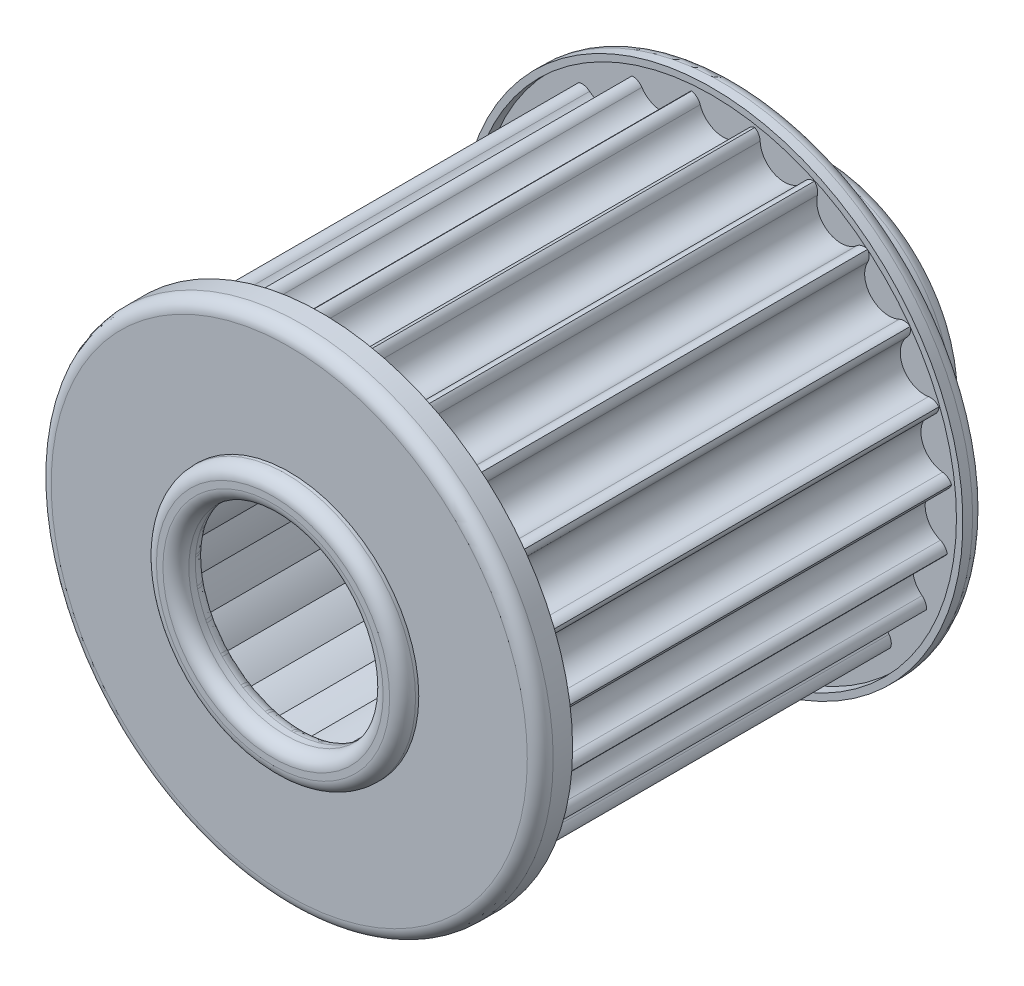
from build123d import *

# Parameters (mm, degrees)
SKETCH3_R                = 72.5
BOSS_EXTRUDE1_DEPTH      = 128
CUT_EXTRUDE1_DEPTH       = 128
FILLET1_R                = 3.5
CIRPATTERN1_COUNT        = 23
FILLET1_OF_CIRPATTERN1_R = 3.5
CUT_EXTRUDE2_DEPTH       = 128
BOSS_EXTRUDE2_DEPTH      = 4
BOSS_EXTRUDE3_START      = -4
SKETCH7_R                = 77.499998443
BOSS_EXTRUDE3_DEPTH      = 10
SKETCH8_R                = 40
CUT_EXTRUDE3_DEPTH       = 27
BOSS_EXTRUDE4_DEPTH      = 53.5
BOSS_EXTRUDE6_START      = 5
SKETCH10_R               = 40
SKETCH10_R_2             = 30
BOSS_EXTRUDE6_DEPTH      = 10
FILLET2_R                = 4


with BuildPart() as part:
    # Sketch2 → Revolve2 (revolve)
    with BuildSketch(Plane(origin=(0, 0, 0), x_dir=(1, 0, 0), z_dir=(0, 1, 0)), mode=Mode.PRIVATE) as revolve2_sk:
        Polygon((37.5, 21.100238458), (37.5, 17.600238458), (39.5, 17.600238458), (39.5, 21.100238458), (75.5, 21.100238458), (75.5, 17.600238458), (77.5, 17.600238458), (77.5, 24.600238458), (50, 24.600238458), (43, 31.600238458), (43, 52.600238458), (37.5, 52.600238458), align=None)
    revolve(revolve2_sk.sketch.rotate(Axis((1.557e-06, 0, -52.600238458), (0, 0, 1)), 180), axis=Axis((1.557e-06, 0, -52.600238458), (0, 0, 1)))

    # Sketch3 → Boss-Extrude1 (add)
    with BuildSketch(Plane.XY.offset(-21.100238458)):
        with Locations(Location((0, 0, 0), (0, 0, 180))):
            Circle(SKETCH3_R)
    extrude(amount=BOSS_EXTRUDE1_DEPTH)

    # Sketch4 → Cut-Extrude1 (cut)
    with BuildSketch(Plane.XY.offset(106.899761542)):
        with BuildLine():
            Line((7.5, 70), (10, 70))
            Line((10, 70), (10, 74.834816737))
            ThreePointArc((10, 74.834816737), (-1.4e-08, 75.499998443), (-10, 74.83481632))
            Line((-10, 74.83481632), (-10, 70))
            Line((-10, 70), (-7.5, 70))
            ThreePointArc((-7.5, 70), (0, 62.5), (7.5, 70))
        make_face()
    cut_extrude1 = extrude(amount=-CUT_EXTRUDE1_DEPTH, mode=Mode.SUBTRACT)

    # Fillet1
    # the kernel refuses this fillet: 3.5 mm, written as the material it takes off along each edge
    with BuildSketch(Plane(origin=(7.5, 70, 113.149761542), x_dir=(-0.15990053726672196, -0.9871331309310886, 0), z_dir=(0, 0, -1))) as fillet1_piece_1:
        with BuildLine():
            CenterArc((2.958159939, -3.454965958), FILLET1_R, 99.201123098, 64.416998023)
            Line((-0.399751343, -2.467832827), (-0.466909569, -2.448090165))
            ThreePointArc((-0.466909569, -2.448090165), (-0.268974991, -1.222723376), (-0.069099319, 0.011193038))
            Line((-0.069099319, 0.011193038), (0.011193038, 0.069099319))
            ThreePointArc((0.011193038, 0.069099319), (1.19925403, -0.026501518), (2.387315021, 0.069099319))
            Line((2.387315021, 0.069099319), (2.398508059, 0))
        make_face()
    extrude(amount=134.25, mode=Mode.SUBTRACT)
    with BuildSketch(Plane(origin=(-7.5, 70, 113.149761542), x_dir=(-1, 0, 0), z_dir=(0, 0, -1))) as fillet1_piece_2:
        with BuildLine():
            CenterArc((2.9375, -3.472548596), FILLET1_R, 97.180755781, 64.416998023)
            Line((-0.383522727, -2.36764677), (-0.449943182, -2.345548733))
            ThreePointArc((-0.449943182, -2.345548733), (-0.165600837, -1.188060992), (-0.07, 0))
            Line((-0.07, 0), (0, 0.07))
            ThreePointArc((0, 0.07), (1.25, 0.07), (2.49125, 0.069450972))
            Line((2.49125, 0.069450972), (2.5, 0))
        make_face()
    extrude(amount=134.25, mode=Mode.SUBTRACT)

    # CirPattern1: Cut-Extrude1 ×23 about axis
    cirpattern1_axis = Axis((0, 0, 106.899761542), (0, 0, 1))
    for i in range(1, CIRPATTERN1_COUNT):
        add(cut_extrude1.rotate(cirpattern1_axis, i * 360 / CIRPATTERN1_COUNT), mode=Mode.SUBTRACT)

    # Fillet1 of CirPattern1
    # the kernel refuses this fillet: 3.5 mm, written as the material it takes off along each edge
    with BuildSketch(Plane(origin=(-11.663894326, 69.427685898, 112.687052105), x_dir=(0.11795967062935775, -0.9930183865896007, 0), z_dir=(0, 0, -1))) as fillet1_of_cirpattern1_piece_1:
        with BuildLine():
            CenterArc((2.855063344, -3.458068983), FILLET1_OF_CIRPATTERN1_R, 98.877809953, 55.66765125)
            Line((-0.305179714, -1.953787158), (-0.368384576, -1.923701521))
            ThreePointArc((-0.368384576, -1.923701521), (-0.221751237, -0.966090636), (-0.06916138, 0.010802942))
            Line((-0.06916138, 0.010802942), (0.010802942, 0.06916138))
            ThreePointArc((0.010802942, 0.06916138), (1.157458113, -0.01985218), (2.304113283, 0.06916138))
            Line((2.304113283, 0.06916138), (2.314916225, 0))
        make_face()
    extrude(amount=133.787290563, mode=Mode.SUBTRACT)
    with BuildSketch(Plane(origin=(-26.107653636, 65.380734331, 112.763038335), x_dir=(-0.962917287347799, -0.2697967711570246, 0), z_dir=(0, 0, -1)), Plane(origin=(-42.779022037, 55.912478693, 112.763038335), x_dir=(-0.8544194045464892, -0.5195839500354325, 0), z_dir=(0, 0, -1)), Plane(origin=(-56.277666074, 42.297450293, 112.763038335), x_dir=(-0.6825531432186525, -0.7308359642781255, 0), z_dir=(0, 0, -1)), Plane(origin=(-65.602453071, 25.545413503, 112.763038335), x_dir=(-0.46006503773115265, -0.8878852184023749, 0), z_dir=(0, 0, -1)), Plane(origin=(-70.061806236, 6.898790256, 112.763038335), x_dir=(-0.20345601305263047, -0.9790840876823237, 0), z_dir=(0, 0, -1)), Plane(origin=(-69.324995743, -12.259484704, 112.763038335), x_dir=(0.06824241336466162, -0.9976687691905398, 0), z_dir=(0, 0, -1)), Plane(origin=(-63.446667457, -30.508529768, 112.763038335), x_dir=(0.33487961217098966, -0.9422609221188193, 0), z_dir=(0, 0, -1)), Plane(origin=(-52.862790095, -46.494896746, 112.763038335), x_dir=(0.5766803221148681, -0.8169698930104413, 0), z_dir=(0, 0, -1)), Plane(origin=(-38.358321423, -59.032949932, 112.763038335), x_dir=(0.7757112907044159, -0.6310879443260576, 0), z_dir=(0, 0, -1)), Plane(origin=(-21.008991528, -67.192799279, 112.763038335), x_dir=(0.9172113015054586, -0.39840108984622863, 0), z_dir=(0, 0, -1)), Plane(origin=(-2.101520841, -70.369266091, 112.763038335), x_dir=(0.9906859460363303, -0.1361666490962488, 0), z_dir=(0, 0, -1)), Plane(origin=(16.961810032, -68.326766354, 112.763038335), x_dir=(0.990685946036331, 0.13616664909624518, 0), z_dir=(0, 0, -1)), Plane(origin=(34.767161051, -61.216782932, 112.763038335), x_dir=(0.9172113015054544, 0.3984010898462381, 0), z_dir=(0, 0, -1)), Plane(origin=(49.993990783, -49.566630767, 112.763038335), x_dir=(0.7757112907044208, 0.6310879443260516, 0), z_dir=(0, 0, -1)), Plane(origin=(61.512994927, -34.24034835, 112.763038335), x_dir=(0.5766803221148689, 0.8169698930104408, 0), z_dir=(0, 0, -1)), Plane(origin=(68.46986164, -16.374615936, 112.763038335), x_dir=(0.3348796121709904, 0.942260922118819, 0), z_dir=(0, 0, -1)), Plane(origin=(70.348631944, 2.705546833, 112.763038335), x_dir=(0.06824241336467309, 0.997668769190539, 0), z_dir=(0, 0, -1)), Plane(origin=(67.00996604, 21.585051571, 112.763038335), x_dir=(-0.20345601305263206, 0.9790840876823232, 0), z_dir=(0, 0, -1)), Plane(origin=(58.701477505, 38.863691779, 112.763038335), x_dir=(-0.46006503773115587, 0.8878852184023734, 0), z_dir=(0, 0, -1)), Plane(origin=(46.039368925, 53.259989757, 112.763038335), x_dir=(-0.6825531432186541, 0.7308359642781241, 0), z_dir=(0, 0, -1)), Plane(origin=(29.962730968, 63.706237944, 112.763038335), x_dir=(-0.8544194045464872, 0.5195839500354358, 0), z_dir=(0, 0, -1))) as fillet1_of_cirpattern1_piece_2:
        with BuildLine():
            CenterArc((2.962175058, -3.397483341), FILLET1_OF_CIRPATTERN1_R, 103.901658842, 58.107671101)
            Line((-0.366698824, -2.316465914), (-0.433276302, -2.294845566))
            ThreePointArc((-0.433276302, -2.294845566), (-0.16138102, -1.161710575), (-0.07, 0))
            Line((-0.07, 0), (0, 0.07))
            ThreePointArc((0, 0.07), (1.060639272, 0.07), (2.104460614, 0.067949667))
            Line((2.104460614, 0.067949667), (2.121278544, 0))
        make_face()
    extrude(amount=133.863276793, mode=Mode.SUBTRACT)
    with BuildSketch(Plane(origin=(-29.962730968, 63.706237944, 112.763038335), x_dir=(0.37960169309444297, -0.9251500173484473, 0), z_dir=(0, 0, -1)), Plane(origin=(-46.039368925, 53.259989757, 112.763038335), x_dir=(0.6151275201036107, -0.7884276339723145, 0), z_dir=(0, 0, -1)), Plane(origin=(-58.701477505, 38.863691779, 112.763038335), x_dir=(0.805032152967851, -0.593231179800882, 0), z_dir=(0, 0, -1)), Plane(origin=(-67.00996604, 21.585051571, 112.763038335), x_dir=(0.9352312338235118, -0.35403748287568637, 0), z_dir=(0, 0, -1)), Plane(origin=(-70.348631944, 2.705546833, 112.763038335), x_dir=(0.9960684924646918, -0.08858644545931603, 0), z_dir=(0, 0, -1)), Plane(origin=(-68.46986164, -16.374615936, 112.763038335), x_dir=(0.9830319077299143, 0.18343464336074958, 0), z_dir=(0, 0, -1)), Plane(origin=(-61.512994927, -34.24034835, 112.763038335), x_dir=(0.8970883434705509, 0.44185122384040426, 0), z_dir=(0, 0, -1)), Plane(origin=(-49.993990783, -49.566630767, 112.763038335), x_dir=(0.7446118406820741, 0.6674977203826642, 0), z_dir=(0, 0, -1)), Plane(origin=(-34.767161051, -61.216782932, 112.763038335), x_dir=(0.5369108840427165, 0.8436389646030277, 0), z_dir=(0, 0, -1)), Plane(origin=(-16.961810032, -68.326766354, 112.763038335), x_dir=(0.28938970333776953, 0.9572113662102418, 0), z_dir=(0, 0, -1)), Plane(origin=(2.101520841, -70.369266091, 112.763038335), x_dir=(0.020405812206061157, 0.9997917797362664, 0), z_dir=(0, 0, -1)), Plane(origin=(21.008991528, -67.192799279, 112.763038335), x_dir=(-0.2500914846665885, 0.9682222107023065, 0), z_dir=(0, 0, -1)), Plane(origin=(38.358321423, -59.032949932, 112.763038335), x_dir=(-0.5020406402139345, 0.8648440296224417, 0), z_dir=(0, 0, -1)), Plane(origin=(52.862790095, -46.494896746, 112.763038335), x_dir=(-0.7167557381597204, 0.6973243232636549, 0), z_dir=(0, 0, -1)), Plane(origin=(63.446667457, -30.508529768, 112.763038335), x_dir=(-0.8783123419455172, 0.4780872618949189, 0), z_dir=(0, 0, -1)), Plane(origin=(69.324995743, -12.259484704, 112.763038335), x_dir=(-0.9747285373408227, 0.2233926554151242, 0), z_dir=(0, 0, -1)), Plane(origin=(70.061806236, 6.898790256, 112.763038335), x_dir=(-0.9988535762079076, -0.047869962363407875, 0), z_dir=(0, 0, -1)), Plane(origin=(65.602453071, 25.545413503, 112.763038335), x_dir=(-0.9488982147787105, -0.3155822840239548, 0), z_dir=(0, 0, -1)), Plane(origin=(56.277666074, 42.297450293, 112.763038335), x_dir=(-0.8285674136798642, -0.5598893113713288, 0), z_dir=(0, 0, -1)), Plane(origin=(42.779022037, 55.912478693, 112.763038335), x_dir=(-0.6467855579520825, -0.7626719098174609, 0), z_dir=(0, 0, -1))) as fillet1_of_cirpattern1_piece_3:
        with BuildLine():
            CenterArc((2.892549884, -3.456953759), FILLET1_OF_CIRPATTERN1_R, 98.995335028, 58.107671101)
            Line((-0.331670487, -2.095189097), (-0.396154894, -2.067953803))
            ThreePointArc((-0.396154894, -2.067953803), (-0.234974319, -1.036649765), (-0.069139075, 0.010944783))
            Line((-0.069139075, 0.010944783), (0.010944783, 0.069139075))
            ThreePointArc((0.010944783, 0.069139075), (1.172655359, -0.022241944), (2.334365934, 0.069139075))
            Line((2.334365934, 0.069139075), (2.345310717, 0))
        make_face()
    extrude(amount=133.863276793, mode=Mode.SUBTRACT)
    with BuildSketch(Plane(origin=(26.107653636, 65.380734331, 112.763038335), x_dir=(0.9629172873477997, -0.2697967711570225, 0), z_dir=(0, 0, -1))) as fillet1_of_cirpattern1_piece_4:
        with BuildLine():
            CenterArc((2.962175058, 3.397483341), FILLET1_OF_CIRPATTERN1_R, 197.990670057, 58.107671101)
            Line((-0.366698824, 2.316465914), (-0.433276302, 2.294845566))
            ThreePointArc((-0.433276302, 2.294845566), (-0.16138102, 1.161710575), (-0.07, 0))
            Line((-0.07, 0), (0, -0.07))
            ThreePointArc((0, -0.07), (1.060639272, -0.07), (2.104460614, -0.067949667))
            Line((2.104460614, -0.067949667), (2.121278544, 0))
        make_face()
    extrude(amount=133.863276793, mode=Mode.SUBTRACT)
    with BuildSketch(Plane(origin=(11.663894326, 69.427685898, 112.687052105), x_dir=(-0.9629172873477976, 0.2697967711570304, 0), z_dir=(0, 0, -1))) as fillet1_of_cirpattern1_piece_5:
        with BuildLine():
            CenterArc((2.976024814, -3.354534855), FILLET1_OF_CIRPATTERN1_R, 106.576728844, 55.66765125)
            Line((-0.357255809, -2.287182856), (-0.423921421, -2.265835816))
            ThreePointArc((-0.423921421, -2.265835816), (-0.159013559, -1.14665517), (-0.07, 0))
            Line((-0.07, 0), (0, 0.07))
            ThreePointArc((0, 0.07), (0.988738959, 0.07), (1.95750698, 0.067090697))
            Line((1.95750698, 0.067090697), (1.977477918, 0))
        make_face()
    extrude(amount=133.787290563, mode=Mode.SUBTRACT)

    # Sketch5 → Cut-Extrude2 (cut)
    with BuildSketch(Plane.XY.offset(106.899761542)):
        with BuildLine():
            ThreePointArc((-44.665046725, 31.528032738), (-38.368888125, 35.834040019), (-34.502584198, 42.40937315))
            ThreePointArc((-34.502584198, 42.40937315), (-27.278157377, 44.857018739), (-21.78122284, 50.145404365))
            ThreePointArc((-21.78122284, 50.145404365), (-14.164330486, 50.553157586), (-7.444447826, 54.162380338))
            ThreePointArc((-7.444447826, 54.162380338), (0, 52.5), (7.444447826, 54.162380338))
            ThreePointArc((7.444447826, 54.162380338), (14.164330486, 50.553157586), (21.78122284, 50.145404365))
            ThreePointArc((21.78122284, 50.145404365), (27.278157377, 44.857018739), (34.502584198, 42.40937315))
            ThreePointArc((34.502584198, 42.40937315), (38.368888125, 35.834040019), (44.665046725, 31.528032738))
            ThreePointArc((44.665046725, 31.528032738), (46.613973966, 24.153414481), (51.514907066, 18.308402369))
            ThreePointArc((51.514907066, 18.308402369), (51.401914603, 10.681440685), (54.544142414, 3.730921553))
            ThreePointArc((54.544142414, 3.730921553), (52.377610383, -3.582726702), (53.528088242, -11.123264648))
            ThreePointArc((53.528088242, -11.123264648), (49.468698411, -17.581179639), (48.54210064, -25.152489195))
            ThreePointArc((48.54210064, -25.152489195), (42.890919383, -30.275716911), (39.955967499, -37.316268684))
            ThreePointArc((39.955967499, -37.316268684), (33.132117077, -40.724842762), (28.406483035, -46.712471235))
            ThreePointArc((28.406483035, -46.712471235), (20.916057217, -48.153593329), (14.750219675, -52.64422349))
            ThreePointArc((14.750219675, -52.64422349), (7.148749078, -52.011012167), (0, -54.67159452))
            ThreePointArc((0, -54.67159452), (-7.148749078, -52.011012167), (-14.750219675, -52.64422349))
            ThreePointArc((-14.750219675, -52.64422349), (-20.916057217, -48.153593329), (-28.406483035, -46.712471235))
            ThreePointArc((-28.406483035, -46.712471235), (-33.132117077, -40.724842762), (-39.955967499, -37.316268684))
            ThreePointArc((-39.955967499, -37.316268684), (-42.890919383, -30.275716911), (-48.54210064, -25.152489195))
            ThreePointArc((-48.54210064, -25.152489195), (-49.468698411, -17.581179639), (-53.528088242, -11.123264648))
            ThreePointArc((-53.528088242, -11.123264648), (-52.377610383, -3.582726702), (-54.544142414, 3.730921553))
            ThreePointArc((-54.544142414, 3.730921553), (-51.401914603, 10.681440685), (-51.514907066, 18.308402369))
            ThreePointArc((-51.514907066, 18.308402369), (-46.613973966, 24.153414481), (-44.665046725, 31.528032738))
        make_face()
    extrude(amount=-CUT_EXTRUDE2_DEPTH, mode=Mode.SUBTRACT)

    # Sketch6 → Boss-Extrude2 (add)
    with BuildSketch(Plane(origin=(0, 0, 59.399761542), x_dir=(-1, 0, 0), z_dir=(0, 0, -1))):
        with BuildLine():
            ThreePointArc((34.502584198, 42.40937315), (38.368888125, 35.834040019), (44.665046725, 31.528032738))
            ThreePointArc((44.665046725, 31.528032738), (46.613973966, 24.153414481), (51.514907066, 18.308402369))
            ThreePointArc((51.514907066, 18.308402369), (51.401914603, 10.681440685), (54.544142414, 3.730921553))
            ThreePointArc((54.544142414, 3.730921553), (52.377610383, -3.582726702), (53.528088242, -11.123264648))
            ThreePointArc((53.528088242, -11.123264648), (49.468698411, -17.581179639), (48.54210064, -25.152489195))
            ThreePointArc((48.54210064, -25.152489195), (42.890919383, -30.275716911), (39.955967499, -37.316268684))
            ThreePointArc((39.955967499, -37.316268684), (33.132117077, -40.724842762), (28.406483035, -46.712471235))
            ThreePointArc((28.406483035, -46.712471235), (20.916057217, -48.153593329), (14.750219675, -52.64422349))
            ThreePointArc((14.750219675, -52.64422349), (7.148749078, -52.011012167), (0, -54.67159452))
            ThreePointArc((0, -54.67159452), (-7.148749078, -52.011012167), (-14.750219675, -52.64422349))
            ThreePointArc((-14.750219675, -52.64422349), (-20.916057217, -48.153593329), (-28.406483035, -46.712471235))
            ThreePointArc((-28.406483035, -46.712471235), (-33.132117077, -40.724842762), (-39.955967499, -37.316268684))
            ThreePointArc((-39.955967499, -37.316268684), (-42.890919383, -30.275716911), (-48.54210064, -25.152489195))
            ThreePointArc((-48.54210064, -25.152489195), (-49.468698411, -17.581179639), (-53.528088242, -11.123264648))
            ThreePointArc((-53.528088242, -11.123264648), (-52.377610383, -3.582726702), (-54.544142414, 3.730921553))
            ThreePointArc((-54.544142414, 3.730921553), (-51.401914603, 10.681440685), (-51.514907066, 18.308402369))
            ThreePointArc((-51.514907066, 18.308402369), (-46.613973966, 24.153414481), (-44.665046725, 31.528032738))
            ThreePointArc((-44.665046725, 31.528032738), (-38.368888125, 35.834040019), (-34.502584198, 42.40937315))
            ThreePointArc((-34.502584198, 42.40937315), (-27.278157377, 44.857018739), (-21.78122284, 50.145404365))
            ThreePointArc((-21.78122284, 50.145404365), (-14.164330486, 50.553157586), (-7.444447826, 54.162380338))
            ThreePointArc((-7.444447826, 54.162380338), (0, 52.5), (7.444447826, 54.162380338))
            ThreePointArc((7.444447826, 54.162380338), (14.164330486, 50.553157586), (21.78122284, 50.145404365))
            ThreePointArc((21.78122284, 50.145404365), (27.278157377, 44.857018739), (34.502584198, 42.40937315))
        make_face()
    extrude(amount=BOSS_EXTRUDE2_DEPTH)

    # Sketch7 → Boss-Extrude3 (add)
    with BuildSketch(Plane.XY.offset(106.899761542).offset(BOSS_EXTRUDE3_START)):
        with Locations(Location((1.557e-06, 0, 0), (0, 0, 180))):
            Circle(SKETCH7_R)
    extrude(amount=BOSS_EXTRUDE3_DEPTH)

    # Sketch8 → Cut-Extrude3 (cut)
    with BuildSketch(Plane.XY.offset(112.899761542)):
        Circle(SKETCH8_R)
    extrude(amount=-CUT_EXTRUDE3_DEPTH, mode=Mode.SUBTRACT)

    # Sketch9 → Boss-Extrude4 (add)
    with BuildSketch(Plane.XY.offset(59.399761542)):
        with BuildLine():
            ThreePointArc((-15.249667084, 35.108254847), (-10.117378918, 36.109398276), (-5.212074263, 37.920656461))
            ThreePointArc((-5.212074263, 37.920656461), (0, 37.5), (5.212074263, 37.920656461))
            ThreePointArc((5.212074263, 37.920656461), (10.117378918, 36.109398276), (15.249667084, 35.108254847))
            ThreePointArc((15.249667084, 35.108254847), (19.484398126, 32.04072767), (24.15626186, 29.69203458))
            ThreePointArc((24.15626186, 29.69203458), (27.40634866, 25.595742871), (31.271297202, 22.073691941))
            ThreePointArc((31.271297202, 22.073691941), (33.29569569, 17.252438915), (36.067083486, 12.81824455))
            ThreePointArc((36.067083486, 12.81824455), (36.715653288, 7.629600489), (38.187939185, 2.612126601))
            ThreePointArc((38.187939185, 2.612126601), (37.412578845, -2.559090501), (37.476570132, -7.787720828))
            ThreePointArc((37.476570132, -7.787720828), (35.334784579, -12.557985456), (33.985735317, -17.60998863))
            ThreePointArc((33.985735317, -17.60998863), (30.636370988, -21.625512079), (27.974333987, -26.126204136))
            ThreePointArc((27.974333987, -26.126204136), (23.665797912, -29.089173401), (19.88820428, -32.7047586))
            ThreePointArc((19.88820428, -32.7047586), (14.940040869, -34.395423806), (10.327057444, -36.857750733))
            ThreePointArc((10.327057444, -36.857750733), (5.106249341, -37.150722976), (0, -38.277172108))
            ThreePointArc((0, -38.277172108), (-5.106249341, -37.150722976), (-10.327057444, -36.857750733))
            ThreePointArc((-10.327057444, -36.857750733), (-14.940040869, -34.395423806), (-19.88820428, -32.7047586))
            ThreePointArc((-19.88820428, -32.7047586), (-23.665797912, -29.089173401), (-27.974333987, -26.126204136))
            ThreePointArc((-27.974333987, -26.126204136), (-30.636370988, -21.625512079), (-33.985735317, -17.60998863))
            ThreePointArc((-33.985735317, -17.60998863), (-35.334784579, -12.557985456), (-37.476570132, -7.787720828))
            ThreePointArc((-37.476570132, -7.787720828), (-37.412578845, -2.559090501), (-38.187939185, 2.612126601))
            ThreePointArc((-38.187939185, 2.612126601), (-36.715653288, 7.629600489), (-36.067083486, 12.81824455))
            ThreePointArc((-36.067083486, 12.81824455), (-33.29569569, 17.252438915), (-31.271297202, 22.073691941))
            ThreePointArc((-31.271297202, 22.073691941), (-27.40634866, 25.595742871), (-24.15626186, 29.69203458))
            ThreePointArc((-24.15626186, 29.69203458), (-19.484398126, 32.04072767), (-15.249667084, 35.108254847))
        make_face()
        with BuildLine():
            ThreePointArc((-21.529279333, 26.463039279), (-17.406062326, 28.623050052), (-13.591272701, 31.290248047))
            ThreePointArc((-13.591272701, 31.290248047), (-9.038191834, 32.257729126), (-4.645263549, 33.796802261))
            ThreePointArc((-4.645263549, 33.796802261), (0, 33.5), (4.645263549, 33.796802261))
            ThreePointArc((4.645263549, 33.796802261), (9.038191834, 32.257729126), (13.591272701, 31.290248047))
            ThreePointArc((13.591272701, 31.290248047), (17.406062326, 28.623050052), (21.529279333, 26.463039279))
            ThreePointArc((21.529279333, 26.463039279), (24.483004803, 22.865530298), (27.870557806, 19.673187948))
            ThreePointArc((27.870557806, 19.673187948), (29.744154816, 15.412178764), (32.144804507, 11.424266266))
            ThreePointArc((32.144804507, 11.424266266), (32.799316937, 6.815776437), (34.035018109, 2.328059018))
            ThreePointArc((34.035018109, 2.328059018), (33.421903768, -2.286120848), (33.401010119, -6.940809718))
            ThreePointArc((33.401010119, -6.940809718), (31.565740891, -11.218467008), (30.289802007, -15.694910349))
            ThreePointArc((30.289802007, -15.694910349), (27.368491416, -19.318790791), (24.932137847, -23.284991279))
            ThreePointArc((24.932137847, -23.284991279), (21.141446135, -25.986328239), (17.72537108, -29.148130927))
            ThreePointArc((17.72537108, -29.148130927), (13.34643651, -30.7265786), (9.203994628, -32.849487049))
            ThreePointArc((9.203994628, -32.849487049), (4.561582745, -33.187979192), (0, -34.114546992))
            ThreePointArc((0, -34.114546992), (-4.561582745, -33.187979192), (-9.203994628, -32.849487049))
            ThreePointArc((-9.203994628, -32.849487049), (-13.34643651, -30.7265786), (-17.72537108, -29.148130927))
            ThreePointArc((-17.72537108, -29.148130927), (-21.141446135, -25.986328239), (-24.932137847, -23.284991279))
            ThreePointArc((-24.932137847, -23.284991279), (-27.368491416, -19.318790791), (-30.289802007, -15.694910349))
            ThreePointArc((-30.289802007, -15.694910349), (-31.565740891, -11.218467008), (-33.401010119, -6.940809718))
            ThreePointArc((-33.401010119, -6.940809718), (-33.421903768, -2.286120848), (-34.035018109, 2.328059018))
            ThreePointArc((-34.035018109, 2.328059018), (-32.799316937, 6.815776437), (-32.144804507, 11.424266266))
            ThreePointArc((-32.144804507, 11.424266266), (-29.744154816, 15.412178764), (-27.870557806, 19.673187948))
            ThreePointArc((-27.870557806, 19.673187948), (-24.483004803, 22.865530298), (-21.529279333, 26.463039279))
        make_face(mode=Mode.SUBTRACT)
    extrude(amount=BOSS_EXTRUDE4_DEPTH)

    # Sketch10 → Boss-Extrude6 (add)
    with BuildSketch(Plane.XY.offset(112.899761542).offset(BOSS_EXTRUDE6_START)):
        Circle(SKETCH10_R)
        Circle(SKETCH10_R_2, mode=Mode.SUBTRACT)
    extrude(amount=-BOSS_EXTRUDE6_DEPTH)

    # Fillet2
    fillet2_edges = [part.edges().sort_by_distance(p)[0] for p in [
        (77.5, 0, -24.600238458),
        (-40, 0, 117.899761542),
        (-30, 0, 107.899761542),
        (-30, 0, 117.899761542),
        (77.5, 0, 112.899761542),
        (43, 0, -52.600238458),
    ]]
    fillet(fillet2_edges, radius=FILLET2_R)


solid = part.part
